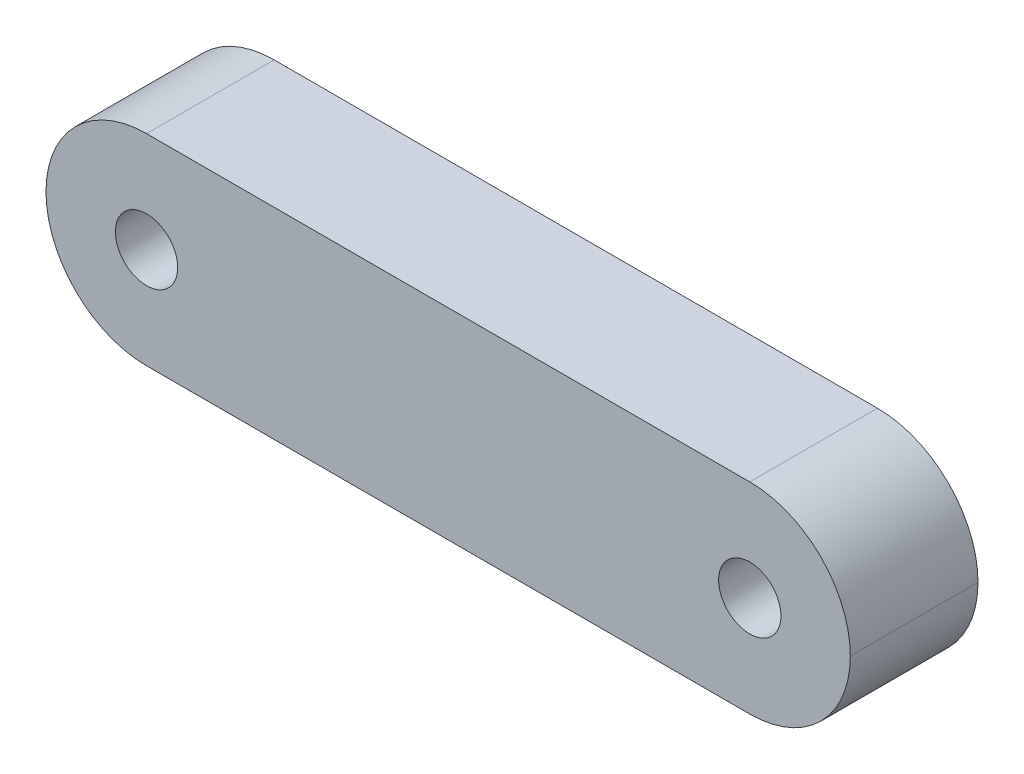
from build123d import *

# Parameters (mm, degrees)
SKETCH1_W           = 40
SKETCH1_H           = 10
SKETCH1_R           = 1.55
BOSS_EXTRUDE1_DEPTH = 6.35
FILLET1_R           = 5


with BuildPart() as part:
    # Sketch1 → Boss-Extrude1 (new body)
    with BuildSketch(Plane.XY):
        with Locations((20, 5)):
            Rectangle(SKETCH1_W, SKETCH1_H)
        with Locations((35, 5)):
            Circle(SKETCH1_R, mode=Mode.SUBTRACT)
        with Locations((5, 5)):
            Circle(SKETCH1_R, mode=Mode.SUBTRACT)
    extrude(amount=BOSS_EXTRUDE1_DEPTH)

    # Fillet1
    fillet1_edges = [part.edges().sort_by_distance(p)[0] for p in [
        (0, 10, 3.175),
        (0, 0, 3.175),
        (40, 10, 3.175),
        (40, 0, 3.175),
    ]]
    fillet(fillet1_edges, radius=FILLET1_R - 0.0001)  # a hair under: the kernel refuses the full size


solid = part.part
